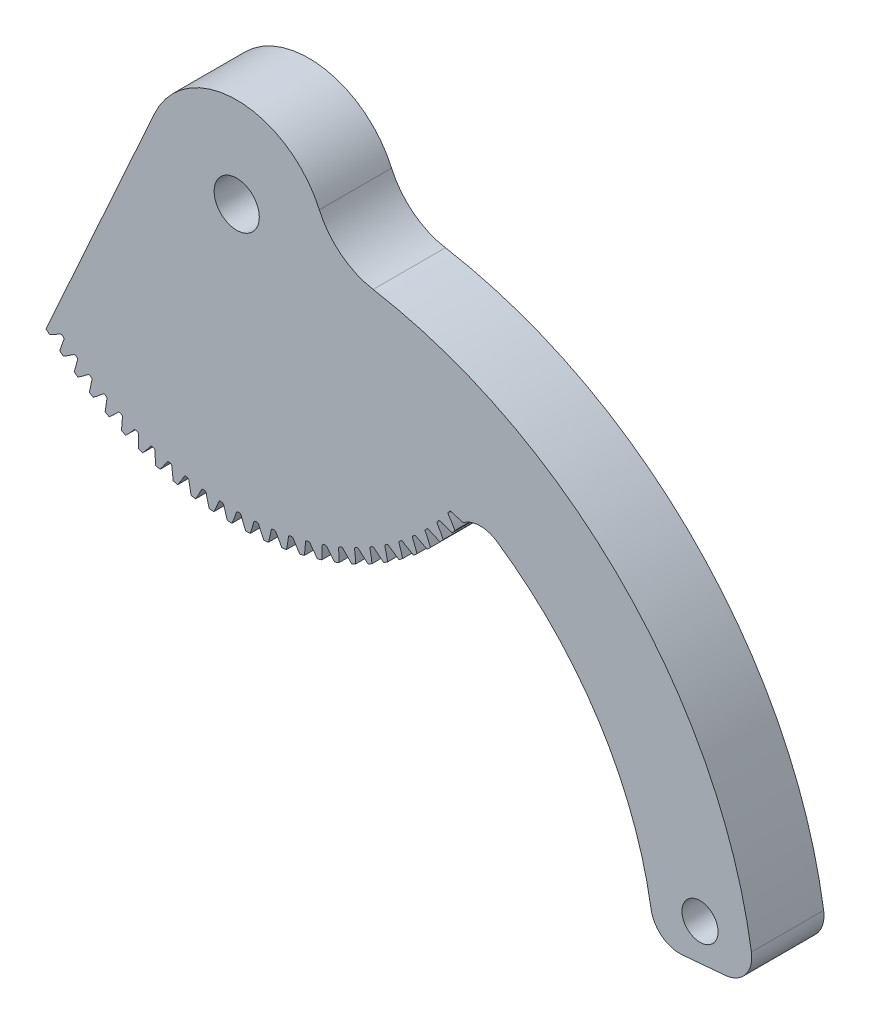
from build123d import *

# Parameters (mm, degrees)
SKETCH1_R          = 3.175
EXTRUDE1_DEPTH     = 12.7
SKETCH2_R          = 3.96875
EXTRUDE2_DEPTH     = 120.050654501
CUT_EXTRUDE1_DEPTH = 120.050654501
CIRPATTERN1_COUNT  = 26
CIRPATTERN1_ANGLE  = 93.75
FILLET1_R          = 12.7
FILLET2_START      = -1
FILLET2_DEPTH      = 15
FILLET2_2_DEPTH    = 12.7


with BuildPart() as part:
    # Sketch1 → Extrude1 (new body)
    with BuildSketch(Plane.XY):
        with BuildLine():
            Line((73.418363329, -75.544443424), (91.130705061, -73.994814318))
            ThreePointArc((91.130705061, -73.994814318), (67.146059716, -23.1217162), (15.875, 0))
            ThreePointArc((15.875, 0), (3.335982078, 15.520529906), (-14.472949427, 6.522987037))
            Line((-14.472949427, 6.522987037), (-33.520950654, -35.739975759))
            ThreePointArc((-33.520950654, -35.739975759), (6.361908891, -48.58524586), (41.592855204, -25.904331607))
            ThreePointArc((41.592855204, -25.904331607), (63.616916223, -46.806276897), (73.418363329, -75.544443424))
        make_face()
        with Locations((81.443110483, -68.468113052)):
            Circle(SKETCH1_R, mode=Mode.SUBTRACT)
    extrude(amount=EXTRUDE1_DEPTH)

    # Sketch2 → Extrude2 (cut, through all)
    with BuildSketch(Plane.XY.offset(12.7)):
        Circle(SKETCH2_R)
    extrude(amount=-EXTRUDE2_DEPTH, mode=Mode.SUBTRACT)

    # Sketch6 → Cut-Extrude1 (cut, through all)
    with BuildSketch(Plane.XY.offset(12.7)):
        with BuildLine():
            ThreePointArc((-32.928910316, -36.286180088), (-32.029908558, -37.082137988), (-31.111673472, -37.855828795))
            add(Edge.make_bspline(
                [(-31.111673472, -37.855828795), (-31.092195991, -37.790032854), (-31.060548772, -37.683729842), (-31.015290744, -37.538096078), (-30.977521794, -37.419184002), (-30.939575079, -37.30255773), (-30.901504849, -37.188206456), (-30.863334037, -37.076128269), (-30.825093727, -36.966318541), (-30.786812622, -36.85877306), (-30.748520606, -36.753486847), (-30.710244844, -36.650455786), (-30.672021565, -36.549671415), (-30.63385395, -36.451139637), (-30.595864505, -36.354812973), (-30.557743503, -36.260835815), (-30.520744268, -36.1686572), (-30.476387728, -36.071276298), (-30.454519121, -35.992538187), (-30.427129742, -35.944472441), (-30.417818338, -35.926244502), (-30.408898148, -35.908015127), (-30.400500951, -35.889571265), (-30.392574321, -35.870749267), (-30.385127189, -35.851304526), (-30.378176428, -35.830922213), (-30.371783259, -35.809181687), (-30.366083243, -35.78552358), (-30.361350266, -35.759208635), (-30.358107149, -35.72928649), (-30.35731028, -35.694616117), (-30.360622264, -35.654054027), (-30.370656145, -35.606977515), (-30.390935696, -35.554458276), (-30.423642787, -35.501156614), (-30.481421172, -35.442029069), (-30.55971436, -35.380043084), (-30.632427306, -35.311596658), (-30.699328796, -35.263031248), (-30.756820298, -35.238423361), (-30.811730396, -35.22599711), (-30.859765635, -35.222916089), (-30.90037816, -35.225538133), (-30.934564066, -35.231368534), (-30.963696473, -35.238928658), (-30.989043362, -35.247438218), (-31.011621024, -35.256518162), (-31.032200689, -35.266005021), (-31.051355489, -35.275846025), (-31.0695105, -35.286041775), (-31.086979657, -35.296621361), (-31.104006264, -35.30761152), (-31.120744607, -35.319087921), (-31.137424636, -35.330951168), (-31.180996245, -35.365039421), (-31.255717007, -35.39812618), (-31.345612021, -35.456172966), (-31.431430003, -35.506184109), (-31.518864272, -35.557566651), (-31.608642201, -35.609160716), (-31.700575891, -35.661251739), (-31.794730132, -35.713725422), (-31.891099546, -35.766577759), (-31.989697774, -35.819774137), (-32.090532838, -35.873288279), (-32.19361401, -35.927091342), (-32.298949633, -35.98115554), (-32.406548805, -36.035450793), (-32.516416751, -36.08995469), (-32.628572053, -36.14461513), (-32.766075852, -36.210571082), (-32.8666464, -36.257341174), (-32.928910316, -36.286180088)],
                knots=[0.009918304, 0.009918304, 0.009918304, 0.009918304, 0.047526931, 0.070708964, 0.093503281, 0.115909882, 0.137928769, 0.15955994, 0.180803395, 0.201659136, 0.222127161, 0.24220747, 0.261900065, 0.281204944, 0.300122107, 0.318651556, 0.336793289, 0.354547306, 0.37731216, 0.381099879, 0.384832618, 0.388531274, 0.392222103, 0.395938471, 0.399723255, 0.403632191, 0.407738511, 0.412139281, 0.416963731, 0.422383144, 0.42861947, 0.43594354, 0.444640843, 0.454908282, 0.466665291, 0.47863304, 0.5, 0.52136696, 0.533334709, 0.545091718, 0.555359157, 0.56405646, 0.57138053, 0.577616856, 0.583036269, 0.587860719, 0.592261489, 0.596367809, 0.600276745, 0.604061529, 0.607777897, 0.611468726, 0.615167382, 0.618900121, 0.62268784, 0.645452694, 0.663206711, 0.681348444, 0.699877893, 0.718795056, 0.738099935, 0.75779253, 0.777872839, 0.798340864, 0.819196605, 0.84044006, 0.862071231, 0.884090118, 0.906496719, 0.929291036, 0.952473069, 0.990081696, 0.990081696, 0.990081696, 0.990081696], degree=3))
        make_face()
    cut_extrude1 = extrude(amount=-CUT_EXTRUDE1_DEPTH, mode=Mode.SUBTRACT)

    # CirPattern1: Cut-Extrude1 ×26 about axis
    cirpattern1_axis = Axis((0, 0, 12.7), (0, 0, 1))
    for i in range(1, CIRPATTERN1_COUNT):
        add(cut_extrude1.rotate(cirpattern1_axis, i * CIRPATTERN1_ANGLE / (CIRPATTERN1_COUNT - 1)), mode=Mode.SUBTRACT)

    # Fillet1
    fillet1_edges = [part.edges().sort_by_distance(p)[0] for p in [
        (15.875, 0, 6.35),
    ]]
    fillet(fillet1_edges, radius=FILLET1_R)

    # Fillet2: read off the stored shape, not the designer's step
    # Fillet2 outline → Fillet2 (cut)
    with BuildSketch(Plane.XY.offset(FILLET2_START)):
        with BuildLine():
            ThreePointArc((91.130705061, -73.994814318), (90.849393312, -71.29822948), (90.47830187, -68.612527108))
            ThreePointArc((90.47830187, -68.612527108), (89.456654772, -72.525426609), (85.901159176, -74.452340298))
            Line((85.901159176, -74.452340298), (91.130705061, -73.994814318))
        make_face()
        with BuildLine():
            Line((73.418363329, -75.544443424), (78.291342391, -75.118112999))
            ThreePointArc((78.291342391, -75.118112999), (74.729702565, -74.067298489), (72.834621498, -70.873843129))
            ThreePointArc((72.834621498, -70.873843129), (73.169783317, -73.203732685), (73.418363329, -75.544443424))
        make_face()
    extrude(amount=FILLET2_DEPTH, mode=Mode.SUBTRACT)

    # Fillet2 2 outline → Fillet2 2 (add)
    with BuildSketch(Plane.XY):
        with BuildLine():
            ThreePointArc((39.80957736, -28.569171328), (42.721882509, -27.57184538), (45.67542899, -28.439453308))
            ThreePointArc((45.67542899, -28.439453308), (43.658132778, -27.133257734), (41.592855204, -25.904331607))
            ThreePointArc((41.592855204, -25.904331607), (40.723019897, -27.251342178), (39.80957736, -28.569171328))
        make_face()
    extrude(amount=FILLET2_2_DEPTH)


solid = part.part
